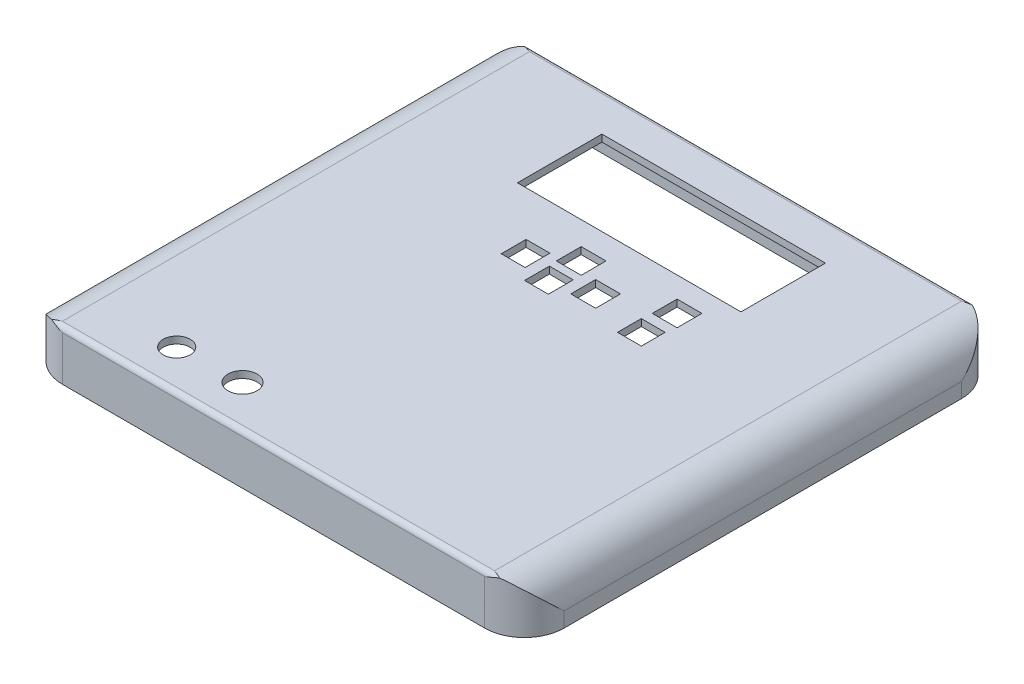
from build123d import *

# Parameters (mm, degrees)
BOSS_EXTRUDE1_DEPTH = 12.7
FILLET1_R           = 8.89
FILLET3_START       = -66
FILLET3_DEPTH       = 116
SHELL1_T            = -1.778
SKETCH4_W           = 57.15
SKETCH4_H           = 21.59
CUT_EXTRUDE2_DEPTH  = 2.54
SKETCH6_W           = 6.35
SKETCH6_H           = 6.35
SKETCH6_W_2         = 6.096
SKETCH6_H_2         = 6.096
CUT_EXTRUDE3_DEPTH  = 2.54
SKETCH8_R           = 3.4544
CUT_EXTRUDE4_DEPTH  = 2.54
SKETCH9_R           = 3.71513614
CUT_EXTRUDE5_DEPTH  = 1.778


with BuildPart() as part:
    # Sketch2 → Boss-Extrude1 (new body)
    with BuildSketch(Plane(origin=(0, 0, 0), x_dir=(1, 0, 0), z_dir=(0, 1, 0))):
        with BuildLine():
            Line((-61.806666667, -53.763333333), (46.143333333, -53.763333333))
            ThreePointArc((46.143333333, -53.763333333), (53.32753823, -50.78753823), (56.303333333, -43.603333333))
            Line((56.303333333, -43.603333333), (56.303333333, 57.996666667))
            ThreePointArc((56.303333333, 57.996666667), (53.32753823, 65.180871564), (46.143333333, 68.156666667))
            Line((46.143333333, 68.156666667), (-61.806666667, 68.156666667))
            ThreePointArc((-61.806666667, 68.156666667), (-68.990871564, 65.180871564), (-71.966666667, 57.996666667))
            Line((-71.966666667, 57.996666667), (-71.966666667, -43.603333333))
            ThreePointArc((-71.966666667, -43.603333333), (-68.990871564, -50.78753823), (-61.806666667, -53.763333333))
        make_face()
    extrude(amount=BOSS_EXTRUDE1_DEPTH)

    # Fillet1
    # the kernel refuses this fillet: 8.89 mm, written as the material it takes off along each edge
    with BuildSketch(Plane(origin=(-71.966666667, 12.7, -80.221666667), x_dir=(0, -1, 0), z_dir=(0, 0, 1)), Plane(origin=(56.303333333, 12.7, 65.828333333), x_dir=(0, -1, 0), z_dir=(0, 0, -1))) as fillet1_piece_1:
        with BuildLine():
            CenterArc((FILLET1_R, FILLET1_R), FILLET1_R, 180, 90)
            Line((0, FILLET1_R), (0, 0))
            Line((0, 0), (FILLET1_R, 0))
        make_face()
    extrude(amount=146.05, mode=Mode.SUBTRACT)

    # Fillet3: read off the stored shape, not the designer's step
    # Fillet3 outline → Fillet3 (cut)
    with BuildSketch(Plane.YZ.offset(FILLET3_START)):
        with BuildLine():
            ThreePointArc((11.43, 53.763333333), (12.328025612, 53.391358945), (12.7, 52.493333333))
            Line((12.7, 52.493333333), (12.7, 53.763333333))
            Line((12.7, 53.763333333), (11.43, 53.763333333))
        make_face()
        with BuildLine():
            ThreePointArc((12.7, -66.886666667), (12.328025612, -67.784692279), (11.43, -68.156666667))
            Line((11.43, -68.156666667), (12.7, -68.156666667))
            Line((12.7, -68.156666667), (12.7, -66.886666667))
        make_face()
    extrude(amount=FILLET3_DEPTH, mode=Mode.SUBTRACT)

    # Shell1
    shell1_openings = [part.faces().sort_by_distance(p)[0] for p in [
        (-7.831666667, 0, -7.196666667),
    ]]
    offset(amount=SHELL1_T, openings=shell1_openings)

    # Sketch4 → Cut-Extrude2 (cut)
    with BuildSketch(Plane(origin=(0, 12.7, 0), x_dir=(1, 0, 0), z_dir=(0, 1, 0))):
        with Locations((-6.985, 47.117)):
            Rectangle(SKETCH4_W, SKETCH4_H)
    extrude(amount=-CUT_EXTRUDE2_DEPTH, mode=Mode.SUBTRACT)

    # Sketch6 → Cut-Extrude3 (cut)
    with BuildSketch(Plane(origin=(0, 12.7, 0), x_dir=(1, 0, 0), z_dir=(0, 1, 0))):
        with Locations((-10.117666667, 27.1653)):
            Rectangle(SKETCH6_W, SKETCH6_H)
        with Locations((-9.990666667, 18.7833)):
            Rectangle(SKETCH6_W_2, SKETCH6_H)
        with Locations((-18.880666667, 21.717)):
            Rectangle(SKETCH6_W_2, SKETCH6_H)
        with Locations((13.758333333, 27.813)):
            Rectangle(SKETCH6_W, SKETCH6_H)
        with Locations((13.377333333, 19.05)):
            Rectangle(SKETCH6_W_2, SKETCH6_H_2)
        with Locations((-0.973666667, 21.717)):
            Rectangle(SKETCH6_W, SKETCH6_H)
    extrude(amount=-CUT_EXTRUDE3_DEPTH, mode=Mode.SUBTRACT)

    # Sketch8 → Cut-Extrude4 (cut)
    with BuildSketch(Plane(origin=(0, 12.7, 0), x_dir=(1, 0, 0), z_dir=(0, 1, 0))):
        with Locations(Location((-42.756666667, -43.603333333, 0), (0, 0, 270))):
            Circle(SKETCH8_R)
    extrude(amount=-CUT_EXTRUDE4_DEPTH, mode=Mode.SUBTRACT)

    # Sketch9 → Cut-Extrude5 (cut)
    with BuildSketch(Plane(origin=(0, 12.7, 0), x_dir=(1, 0, 0), z_dir=(0, 1, 0))):
        with Locations(Location((-26.517778278, -43.01465685, 0), (0, 0, 270))):
            Circle(SKETCH9_R)
    extrude(amount=-CUT_EXTRUDE5_DEPTH, mode=Mode.SUBTRACT)


solid = part.part
